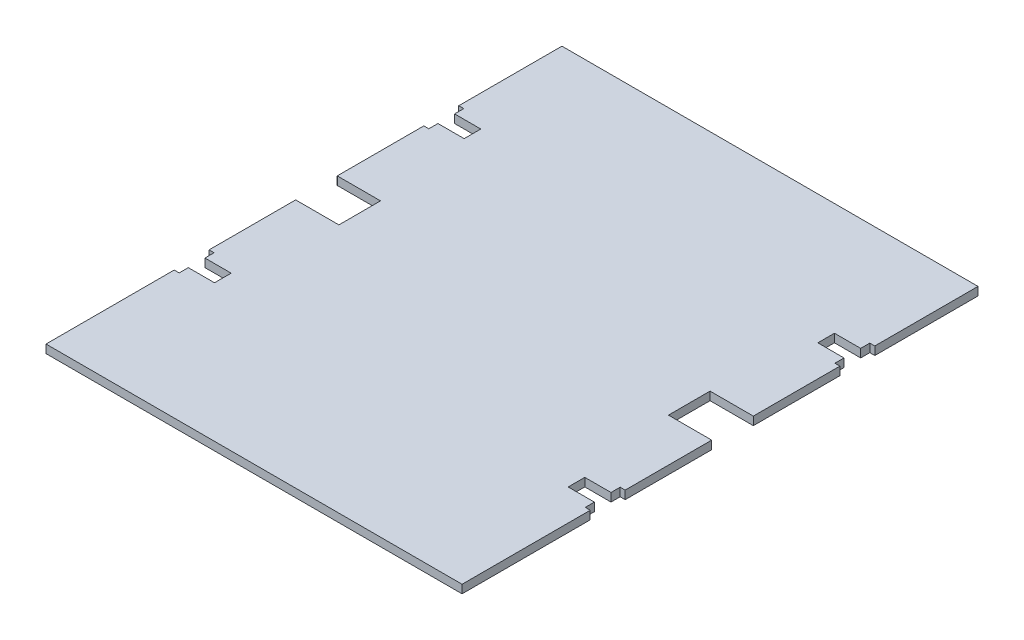
from build123d import *

# Parameters (mm, degrees)
SKETCH1_W           = 500
SKETCH1_H           = 620
BOSS_EXTRUDE1_DEPTH = 10
SKETCH2_W           = 52
SKETCH2_H           = 50
CUT_EXTRUDE1_DEPTH  = 10


with BuildPart() as part:
    # Sketch1 → Boss-Extrude1 (new body)
    with BuildSketch(Plane(origin=(0, 0, 0), x_dir=(1, 0, 0), z_dir=(0, 1, 0))):
        Rectangle(SKETCH1_W, SKETCH1_H)
    extrude(amount=BOSS_EXTRUDE1_DEPTH)

    # Sketch2 → Cut-Extrude1 (cut)
    with BuildSketch(Plane(origin=(0, 10, 0), x_dir=(1, 0, 0), z_dir=(0, 1, 0))):
        with Locations((-224, 15)):
            Rectangle(SKETCH2_W, SKETCH2_H)
        with Locations((224, 15)):
            Rectangle(SKETCH2_W, SKETCH2_H)
        Polygon((-250, 186), (-244, 186), (-244, 175), (-212.5, 175), (-212.5, 155), (-244, 155), (-244, 144), (-250, 144), align=None)
        Polygon((212.5, 175), (212.5, 155), (244, 155), (244, 144), (250, 144), (250, 186), (244, 186), (244, 175), align=None)
        Polygon((212.5, -125), (212.5, -145), (244, -145), (244, -156), (250, -156), (250, -114), (244, -114), (244, -125), align=None)
        Polygon((-250, -114), (-244, -114), (-244, -125), (-212.5, -125), (-212.5, -145), (-244, -145), (-244, -156), (-250, -156), align=None)
    extrude(amount=-CUT_EXTRUDE1_DEPTH, mode=Mode.SUBTRACT)


solid = part.part
